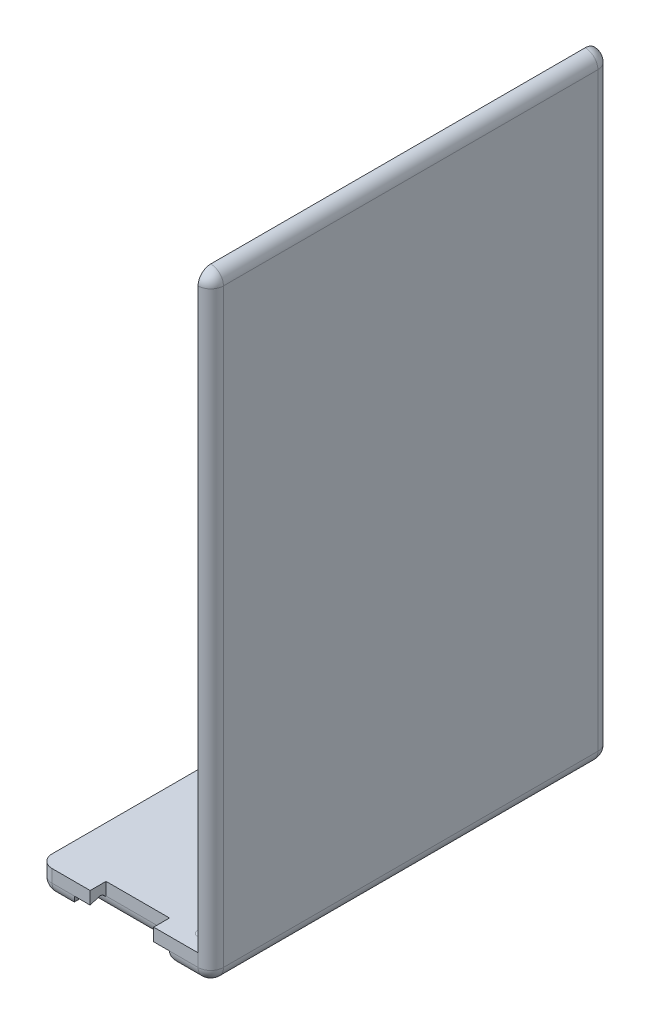
from build123d import *

# Parameters (mm, degrees)
SKETCH1_W           = 25
SKETCH1_H           = 63
BOSS_EXTRUDE1_DEPTH = 4
SKETCH3_W           = 63
SKETCH3_H           = 4
BOSS_EXTRUDE2_DEPTH = 2
SKETCH4_W           = 2
SKETCH4_H           = 63
BOSS_EXTRUDE3_DEPTH = 93
SKETCH6_W           = 10
SKETCH6_H           = 2.5
CUT_EXTRUDE1_DEPTH  = 119.334272297
SKETCH6_3_W         = 10
SKETCH6_3_H         = 2.5
CUT_EXTRUDE2_DEPTH  = 80
SKETCH8_W           = 15
SKETCH8_H           = 2
CUT_EXTRUDE3_DEPTH  = 2.5
CUT_EXTRUDE5_DEPTH  = 15
SKETCH11_W          = 15
SKETCH11_H          = 2
CUT_EXTRUDE6_DEPTH  = 3
CUT_EXTRUDE7_DEPTH  = 15
FILLET6_R           = 2
FILLET7_R           = 2
BOSS_EXTRUDE4_DEPTH = 79
FILLET8_R           = 0.4
FILLET9_R           = 2
CUT_EXTRUDE8_DEPTH  = 2


# Some blends are built 0.0001 mm under size
with BuildPart() as part:
    # Sketch1 → Boss-Extrude1 (new body)
    with BuildSketch(Plane(origin=(0, 0, 0), x_dir=(1, 0, 0), z_dir=(0, 1, 0))):
        with Locations((-12.5, -31.5)):
            Rectangle(SKETCH1_W, SKETCH1_H)
    extrude(amount=BOSS_EXTRUDE1_DEPTH)

    # Sketch3 → Boss-Extrude2 (add)
    with BuildSketch(Plane(origin=(0, 0, 0), x_dir=(0, 0, -1), z_dir=(1, 0, 0))):
        with Locations((-31.5, 2)):
            Rectangle(SKETCH3_W, SKETCH3_H)
    extrude(amount=BOSS_EXTRUDE2_DEPTH)

    # Sketch4 → Boss-Extrude3 (add)
    with BuildSketch(Plane(origin=(0, 4, 0), x_dir=(1, 0, 0), z_dir=(0, 1, 0))):
        with Locations((1, -31.5)):
            Rectangle(SKETCH4_W, SKETCH4_H)
    extrude(amount=BOSS_EXTRUDE3_DEPTH)

    # Sketch6 → Cut-Extrude1 (cut, through all)
    with BuildSketch(Plane.XZ):
        with Locations((-12, 1.25)):
            Rectangle(SKETCH6_W, SKETCH6_H)
    extrude(amount=-CUT_EXTRUDE1_DEPTH, mode=Mode.SUBTRACT)

    # Sketch6<3> → Cut-Extrude2 (cut)
    with BuildSketch(Plane.XZ):
        with Locations((-12, 61.75)):
            Rectangle(SKETCH6_3_W, SKETCH6_3_H)
    extrude(amount=-CUT_EXTRUDE2_DEPTH, mode=Mode.SUBTRACT)

    # Sketch8 → Cut-Extrude3 (cut)
    with BuildSketch(Plane.XY.offset(63)):
        with Locations((-12, 1)):
            Rectangle(SKETCH8_W, SKETCH8_H)
    extrude(amount=-CUT_EXTRUDE3_DEPTH, mode=Mode.SUBTRACT)

    # Sketch9 → Cut-Extrude5 (cut)
    with BuildSketch(Plane.ZY.offset(4.5)):
        with BuildLine():
            ThreePointArc((61.5, 2.5), (61, 2.366025404), (60.633974596, 2))
            Line((60.633974596, 2), (63, 2))
            Line((63, 2), (61.5, 2.5))
        make_face()
    extrude(amount=CUT_EXTRUDE5_DEPTH, mode=Mode.SUBTRACT)

    # Sketch11 → Cut-Extrude6 (cut)
    with BuildSketch(Plane(origin=(0, 0, 0), x_dir=(-1, 0, 0), z_dir=(0, 0, -1))):
        with Locations((12, 1)):
            Rectangle(SKETCH11_W, SKETCH11_H)
    extrude(amount=-CUT_EXTRUDE6_DEPTH, mode=Mode.SUBTRACT)

    # Sketch12 → Cut-Extrude7 (cut)
    with BuildSketch(Plane.ZY.offset(4.5)):
        with BuildLine():
            ThreePointArc((2.766025404, 2), (2.4, 2.366025404), (1.9, 2.5))
            Line((1.9, 2.5), (0, 2))
            Line((0, 2), (2.766025404, 2))
        make_face()
    extrude(amount=CUT_EXTRUDE7_DEPTH, mode=Mode.SUBTRACT)

    # Fillet6
    fillet6_edges = [part.edges().sort_by_distance(p)[0] for p in [
        (-22.25, 0, 0),
        (-12, 0, 3),
        (-19.5, 0, 1.5),
        (-4.5, 0, 1.5),
        (2, 0, 31.5),
        (-22.25, 0, 63),
        (-25, 0, 31.5),
        (-1.25, 0, 0),
        (-12, 0, 60.5),
        (-1.25, 0, 63),
        (-4.5, 0, 61.75),
        (-19.5, 0, 61.75),
    ]]
    fillet(fillet6_edges, radius=FILLET6_R - 0.0001)  # a hair under: the kernel refuses the full size

    # Fillet7
    # the kernel refuses this fillet: 2 mm, written as the material it takes off along each edge
    with BuildSketch(Plane(origin=(-23, 0, 61), x_dir=(0, 0, 1), z_dir=(1, 0, 0))) as fillet7_piece_1:
        with BuildLine():
            CenterArc((0.0001, -1.9999), 1.9999, 0, 90)
            Line((2, -1.9999), (2, 0))
            Line((2, 0), (0.0001, 0))
        make_face()
    revolve(axis=Axis((-23, 0, 61), (0, -1, 0)), revolution_arc=90, mode=Mode.SUBTRACT)
    with BuildSketch(Plane(origin=(-23, 0, 2), x_dir=(-1, 0, 0), z_dir=(0, 0, 1))) as fillet7_piece_2:
        with BuildLine():
            CenterArc((0.0001, -1.9999), 1.9999, 0, 90)
            Line((2, -1.9999), (2, 0))
            Line((2, 0), (0.0001, 0))
        make_face()
    revolve(axis=Axis((-23, 0, 2), (0, -1, 0)), revolution_arc=90, mode=Mode.SUBTRACT)
    with BuildSketch(Plane(origin=(-25, 0, 63), x_dir=(0, 0, -1), z_dir=(0, 1, 0)), Plane(origin=(-25, 0, 0), x_dir=(1, 0, 0), z_dir=(0, 1, 0))) as fillet7_piece_3:
        with BuildLine():
            CenterArc((FILLET7_R, -FILLET7_R), FILLET7_R, 90, 90)
            Line((0, -FILLET7_R), (0, 0))
            Line((0, 0), (FILLET7_R, 0))
        make_face()
    extrude(amount=9, mode=Mode.SUBTRACT)

    # Sketch13 → Boss-Extrude4 (add)
    with BuildSketch(Plane(origin=(0, 4, 0), x_dir=(1, 0, 0), z_dir=(0, 1, 0))):
        Polygon((0, -4.25), (-1.5, -4.25), (-1.5, -2.6), (-2.7, -2.6), (-2.7, -5.6), (0, -5.6), align=None)
        Polygon((-1.5, -60.4), (-2.7, -60.4), (-2.7, -57.4), (0, -57.4), (0, -58.75), (-1.5, -58.75), align=None)
    extrude(amount=BOSS_EXTRUDE4_DEPTH)

    # Fillet8
    fillet8_edges = [part.edges().sort_by_distance(p)[0] for p in [
        (0, 43.5, 5.6),
        (-1.5, 4, 3.425),
        (-2.1, 4, 2.6),
        (-1.5, 43.5, 2.6),
        (-2.7, 4, 4.1),
        (-2.7, 43.5, 2.6),
        (-1.35, 4, 5.6),
        (-2.7, 43.5, 5.6),
        (0, 83, 4.925),
        (-2.1, 83, 2.6),
        (-2.7, 83, 4.1),
        (-1.35, 83, 5.6),
        (-1.5, 4, 59.575),
        (-1.5, 43.5, 60.4),
        (-1.35, 4, 57.4),
        (0, 43.5, 57.4),
        (-2.7, 4, 58.9),
        (-2.7, 43.5, 57.4),
        (-2.1, 4, 60.4),
        (-2.7, 43.5, 60.4),
        (0, 83, 58.075),
        (-1.35, 83, 57.4),
        (-2.7, 83, 58.9),
        (-2.1, 83, 60.4),
    ]]
    fillet(fillet8_edges, radius=FILLET8_R)

    # Fillet9
    # the kernel refuses this fillet: 2 mm, written as the material it takes off along each edge
    with BuildSketch(Plane(origin=(0, 0, 61), x_dir=(1, 0, 0), z_dir=(0, 0, -1))) as fillet9_piece_1:
        with BuildLine():
            CenterArc((0.0001, -1.9999), 1.9999, 0, 90)
            Line((2, -1.9999), (2, 0))
            Line((2, 0), (0.0001, 0))
        make_face()
    revolve(axis=Axis((0, 0, 61), (0, -1, 0)), revolution_arc=90, mode=Mode.SUBTRACT)
    with BuildSketch(Plane(origin=(0, 0, 2), x_dir=(0, 0, -1), z_dir=(-1, 0, 0))) as fillet9_piece_2:
        with BuildLine():
            CenterArc((0.0001, -1.9999), 1.9999, 0, 90)
            Line((2, -1.9999), (2, 0))
            Line((2, 0), (0.0001, 0))
        make_face()
    revolve(axis=Axis((0, 0, 2), (0, -1, 0)), revolution_arc=90, mode=Mode.SUBTRACT)
    with BuildSketch(Plane(origin=(0, 95, 61), x_dir=(0, 0, 1), z_dir=(1, 0, 0))) as fillet9_piece_3_section:
        Polygon((0, 0), (FILLET9_R, 0), (FILLET9_R, -FILLET9_R), (0, -FILLET9_R), align=None)
    fillet9_piece_3 = extrude(amount=FILLET9_R, mode=Mode.PRIVATE)
    fillet9_piece_3 = fillet9_piece_3 - Plane(origin=(0, 95, 61), x_dir=(0, -0.7071067811865475, -0.7071067811865475), z_dir=(1, 0, 0)) * Sphere(FILLET9_R, mode=Mode.PRIVATE)
    add(fillet9_piece_3, mode=Mode.SUBTRACT)
    with BuildSketch(Plane(origin=(0, 95, 2), x_dir=(0, 0, -1), z_dir=(0, 1, 0))) as fillet9_piece_4_section:
        Polygon((0, 0), (FILLET9_R, 0), (FILLET9_R, -FILLET9_R), (0, -FILLET9_R), align=None)
    fillet9_piece_4 = extrude(amount=FILLET9_R, mode=Mode.PRIVATE)
    fillet9_piece_4 = fillet9_piece_4 - Plane(origin=(0, 95, 2), x_dir=(-0.7071067811865474, 0, 0.7071067811865476), z_dir=(0, 1, 0)) * Sphere(FILLET9_R, mode=Mode.PRIVATE)
    add(fillet9_piece_4, mode=Mode.SUBTRACT)
    with BuildSketch(Plane(origin=(2, 95, 63), x_dir=(-1, 0, 0), z_dir=(0, -1, 0)), Plane(origin=(2, 95, 0), x_dir=(0, 0, 1), z_dir=(0, -1, 0))) as fillet9_piece_5:
        with BuildLine():
            CenterArc((FILLET9_R, FILLET9_R), FILLET9_R, 180, 90)
            Line((0, FILLET9_R), (0, 0))
            Line((0, 0), (FILLET9_R, 0))
        make_face()
    extrude(amount=95, mode=Mode.SUBTRACT)
    with BuildSketch(Plane(origin=(2, 97, 2), x_dir=(-1, 0, 0), z_dir=(0, 0, 1))) as fillet9_piece_6:
        with BuildLine():
            CenterArc((FILLET9_R, FILLET9_R), FILLET9_R, 180, 90)
            Line((0, FILLET9_R), (0, 0))
            Line((0, 0), (FILLET9_R, 0))
        make_face()
    extrude(amount=59, mode=Mode.SUBTRACT)
    with BuildSketch(Plane(origin=(-5, 97, 0), x_dir=(0, 0, 1), z_dir=(1, 0, 0))) as fillet9_piece_7:
        with BuildLine():
            CenterArc((FILLET9_R, FILLET9_R), FILLET9_R, 180, 90)
            Line((0, FILLET9_R), (0, 0))
            Line((0, 0), (FILLET9_R, 0))
        make_face()
    extrude(amount=5, mode=Mode.SUBTRACT)
    with BuildSketch(Plane(origin=(0, 97, 63), x_dir=(0, -1, 0), z_dir=(-1, 0, 0))) as fillet9_piece_8:
        with BuildLine():
            CenterArc((FILLET9_R, -FILLET9_R), FILLET9_R, 90, 90)
            Line((0, -FILLET9_R), (0, 0))
            Line((0, 0), (FILLET9_R, 0))
        make_face()
    extrude(amount=5, mode=Mode.SUBTRACT)

    # Sketch14 → Cut-Extrude8 (cut)
    with BuildSketch(Plane(origin=(0, 0, 0), x_dir=(-1, 0, 0), z_dir=(0, -1, 0))):
        Polygon((2.475, -45.549038462), (2.475, -40.420192308), (4.184615385, -40.420192308), (4.184615385, -43.839423077), (6.016346154, -43.839423077), (6.016346154, -40.420192308), (7.725961538, -40.420192308), (7.725961538, -43.839423077), (10.290384615, -43.839423077), (10.290384615, -40.420192308), (12, -40.420192308), (12, -45.549038462), align=None)
        Polygon((2.475, -37.956896034), (2.475, -36.182406851), (9.118840144, -34.009134615), (2.475, -31.820597957), (2.475, -30.06328125), (12, -28.452884615), (12, -30.183488582), (5.983909255, -31.200480769), (12, -33.181039663), (12, -34.848677885), (5.983909255, -36.817788462), (12, -37.832872596), (12, -39.565384615), align=None)
        with BuildLine():
            Line((3.98999399, -18.136042668), (5.228320312, -19.429702524))
            add(Edge.make_bspline(
                [(5.228320312, -19.429702524), (5.125776286, -19.532123832), (4.924567975, -19.733091348), (4.662681532, -20.06174858), (4.440026282, -20.402137727), (4.256943561, -20.755379148), (4.114928686, -21.121964909), (4.013340901, -21.50117158), (3.953087465, -21.893616081), (3.944652189, -22.159283491), (3.940384615, -22.293689904)],
                knots=[0, 0, 0, 0, 1.075575784, 2.110457258, 3.113929901, 4.09197124, 5.059417775, 6.02750972, 7.002078037, 8, 8, 8, 8], degree=3))
            add(Edge.make_bspline(
                [(3.940384615, -22.293689904), (3.943374885, -22.410216155), (3.94924654, -22.639025663), (3.993835496, -22.975239195), (4.068319334, -23.296511834), (4.17150428, -23.604361338), (4.305780414, -23.896908423), (4.469075756, -24.17584725), (4.66263795, -24.439464677), (4.882803718, -24.685671772), (5.123162257, -24.909882096), (5.380495941, -25.105493132), (5.650200477, -25.272907055), (5.933784958, -25.408584567), (6.229162036, -25.514411621), (6.537532098, -25.58840904), (6.858234137, -25.635837219), (7.077055288, -25.641408735), (7.187890625, -25.644230769)],
                knots=[0, 0, 0, 0, 1.07501736, 2.110890821, 3.123068569, 4.114115229, 5.101558292, 6.087971832, 7.091606401, 8.114127012, 9.131531654, 10.119863779, 11.092210096, 12.055570724, 13.015277632, 13.98177939, 14.977748899, 16, 16, 16, 16], degree=3))
            add(Edge.make_bspline(
                [(7.187890625, -25.644230769), (7.302559057, -25.641591311), (7.528471565, -25.636391218), (7.86000789, -25.58643845), (8.178969694, -25.509477595), (8.482990501, -25.396827477), (8.776234425, -25.258189107), (9.053023109, -25.082373544), (9.317575484, -24.877352245), (9.565315976, -24.643504509), (9.793583316, -24.389099095), (9.990816731, -24.113714092), (10.15992885, -23.824844246), (10.298093048, -23.520666937), (10.402463754, -23.2015735), (10.479617793, -22.869108403), (10.526084809, -22.521428344), (10.531743553, -22.284290532), (10.534615385, -22.163942308)],
                knots=[0, 0, 0, 0, 1.022033888, 2.013546672, 2.983454993, 3.943493592, 4.899972998, 5.871025147, 6.861547676, 7.880838944, 8.905404004, 9.905061033, 10.896427776, 11.886495431, 12.878446209, 13.885654703, 14.926962766, 16, 16, 16, 16], degree=3))
            add(Edge.make_bspline(
                [(10.534615385, -22.163942308), (10.533909018, -22.08565574), (10.532522265, -21.931961788), (10.510011348, -21.706518951), (10.477829376, -21.490598863), (10.435224267, -21.283365325), (10.374930392, -21.086910838), (10.30442413, -20.898515356), (10.221212683, -20.719282711), (10.1224251, -20.550184684), (10.011696295, -20.388704605), (9.884998995, -20.236353958), (9.745189758, -20.090460336), (9.590560618, -19.952728485), (9.419729005, -19.825489558), (9.23583418, -19.704667142), (9.037051098, -19.591644633), (8.896680554, -19.524862614), (8.825, -19.490760216)],
                knots=[0, 0, 0, 0, 1.109579412, 2.178351274, 3.208885622, 4.204702371, 5.174744997, 6.119429583, 7.05542196, 7.97267548, 8.893247984, 9.828544973, 10.778894627, 11.756245826, 12.760884819, 13.796418446, 14.874735809, 16, 16, 16, 16], degree=3))
            Line((8.825, -19.490760216), (8.825, -22.225))
            Line((8.825, -22.225), (7.115384615, -22.225))
            Line((7.115384615, -22.225), (7.115384615, -17.47585637))
            Line((7.115384615, -17.47585637), (7.52179988, -17.4625))
            add(Edge.make_bspline(
                [(7.52179988, -17.4625), (7.626177632, -17.464216194), (7.834746864, -17.46764552), (8.145270921, -17.498985959), (8.451676516, -17.550900923), (8.753655922, -17.621873632), (9.052690386, -17.710820449), (9.345916669, -17.824255263), (9.635322328, -17.957087555), (9.919681432, -18.105913633), (10.19252055, -18.273162811), (10.450903665, -18.453189759), (10.69419405, -18.643615881), (10.919364071, -18.847598685), (11.126165453, -19.064693786), (11.317204086, -19.292279466), (11.494147584, -19.530434869), (11.65013288, -19.783378393), (11.789204926, -20.046858809), (11.912847626, -20.320861588), (12.014984322, -20.606990673), (12.099400754, -20.90396336), (12.164336118, -21.211919658), (12.208912749, -21.530734053), (12.23918925, -21.860618132), (12.242529946, -22.084370139), (12.244230769, -22.19828726)],
                knots=[0, 0, 0, 0, 1.006947556, 2.012098127, 3.007912615, 4.003802745, 5.003693661, 6.015789779, 7.034654729, 8.075083123, 9.110776623, 10.12033905, 11.112364132, 12.089932562, 13.049221985, 14.003156825, 14.955669239, 15.909347409, 16.867458246, 17.828943829, 18.807340259, 19.796171017, 20.806031855, 21.841452577, 22.901035528, 24, 24, 24, 24], degree=3))
            add(Edge.make_bspline(
                [(12.244230769, -22.19828726), (12.242530783, -22.319824622), (12.239160904, -22.560747924), (12.208283983, -22.917065862), (12.155744699, -23.262607436), (12.088528746, -23.599207003), (11.995983704, -23.924417756), (11.885705845, -24.241017744), (11.753092185, -24.546436853), (11.603244095, -24.842185565), (11.433200961, -25.124368456), (11.246061244, -25.392383897), (11.040590101, -25.644760844), (10.820235369, -25.884086625), (10.579578463, -26.104768937), (10.326420992, -26.315032496), (10.051477355, -26.504688482), (9.763663746, -26.681900191), (9.463091673, -26.839311557), (9.15535396, -26.977061809), (8.842680264, -27.093984659), (8.522939821, -27.187645801), (8.198016541, -27.261842754), (7.866748868, -27.316003429), (7.53000052, -27.346303499), (7.303702723, -27.351320774), (7.189798678, -27.353846154)],
                knots=[0, 0, 0, 0, 1.08412885, 2.149066736, 3.187446822, 4.201211187, 5.20898726, 6.20137506, 7.190057482, 8.177191892, 9.15710824, 10.126769281, 11.090919562, 12.058536462, 13.026153363, 14.001871638, 14.991985849, 16.003078977, 17.015762975, 18.016485971, 19.009327865, 19.991410284, 20.986600416, 21.980997625, 22.983761488, 24, 24, 24, 24], degree=3))
            add(Edge.make_bspline(
                [(7.189798678, -27.353846154), (7.034405024, -27.350478043), (6.72754863, -27.343827022), (6.275591013, -27.281993341), (5.838788007, -27.186278913), (5.418348483, -27.046866587), (5.012577458, -26.871114832), (4.621831972, -26.656646892), (4.246613771, -26.401685065), (4.014333041, -26.204235607), (3.896499399, -26.104071514)],
                knots=[0, 0, 0, 0, 1.034063014, 2.041967874, 3.031271063, 4.007437694, 4.986016733, 5.971461028, 6.970942901, 8, 8, 8, 8], degree=3))
            add(Edge.make_bspline(
                [(3.896499399, -26.104071514), (3.828327394, -26.04188494), (3.693006989, -25.918445526), (3.504976533, -25.721127847), (3.328220947, -25.518806136), (3.166488225, -25.308678205), (3.016237957, -25.091848659), (2.880286706, -24.867693423), (2.754305712, -24.637388364), (2.644728041, -24.399137382), (2.546482518, -24.154187753), (2.463352992, -23.901454633), (2.38971999, -23.642830943), (2.333704162, -23.37602656), (2.287058454, -23.103736846), (2.255794058, -22.824028996), (2.232879482, -22.537665233), (2.231478212, -22.343983186), (2.230769231, -22.245988582)],
                knots=[0, 0, 0, 0, 1.020590567, 2.025856924, 3.013483481, 3.991664875, 4.957826714, 5.930500614, 6.890802512, 7.860442893, 8.829981142, 9.809047939, 10.802672283, 11.803273349, 12.823572789, 13.857849586, 14.916166035, 16, 16, 16, 16], degree=3))
            add(Edge.make_bspline(
                [(2.230769231, -22.245988582), (2.232348973, -22.143552405), (2.235492079, -21.939742028), (2.257240326, -21.636709748), (2.290792743, -21.337888304), (2.341123286, -21.044536961), (2.403191321, -20.755671228), (2.482715836, -20.472786344), (2.57307001, -20.194036836), (2.645107032, -20.012571962), (2.681069712, -19.921980168)],
                knots=[0, 0, 0, 0, 1.03180557, 2.052914215, 3.058998889, 4.059601663, 5.049854447, 6.033765722, 7.018406786, 8, 8, 8, 8], degree=3))
            add(Edge.make_bspline(
                [(2.681069712, -19.921980168), (2.714294569, -19.845750458), (2.781873009, -19.690701337), (2.905727948, -19.465272384), (3.042334793, -19.238362213), (3.200629648, -19.0161221), (3.371628832, -18.792116862), (3.561267133, -18.570917212), (3.767799283, -18.350863396), (3.914969895, -18.208576938), (3.98999399, -18.136042668)],
                knots=[0, 0, 0, 0, 0.894422958, 1.819231551, 2.765348375, 3.743239639, 4.753552307, 5.797344382, 6.877138289, 8, 8, 8, 8], degree=3))
        make_face()
    extrude(amount=-CUT_EXTRUDE8_DEPTH, mode=Mode.SUBTRACT)


solid = part.part
